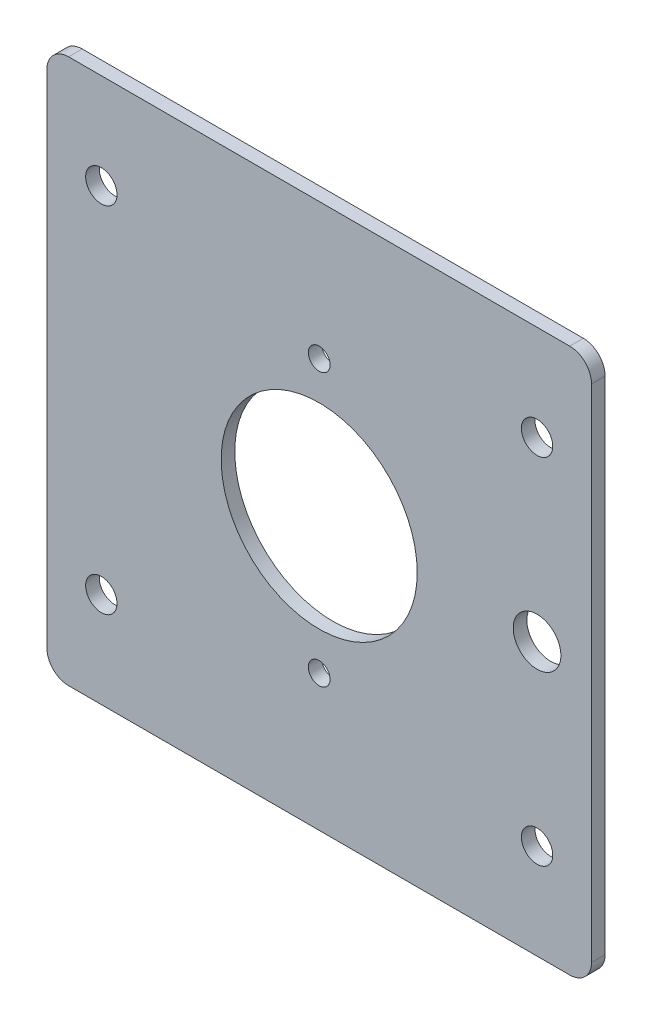
from build123d import *

# Parameters (mm, degrees)
SKETCH3_W                       = 63.5
SKETCH3_H                       = 1.5875
BASE_FLANGE1_DEPTH              = 31.75
FILLET1_R                       = 2.54
F_27_0_144_DIAMETER_HOLE1_D     = 3.6576
SKETCH10_R                      = 11.43
SKETCH10_R_2                    = 1.27
CUT_EXTRUDE1_DEPTH              = 45.929335141
F_7_32_0_21875_DIAMETER_HOLE1_D = 5.55625


# Sheet-metal steps are written as plain solids
with BuildPart() as part:
    # Sketch3 → Base-Flange1 (new, symmetric)
    with BuildSketch(Plane(origin=(0, 0, 0), x_dir=(-1, 0, 0), z_dir=(0, 1, 0))):
        with Locations((0, -0.79375)):
            Rectangle(SKETCH3_W, SKETCH3_H)
    extrude(amount=BASE_FLANGE1_DEPTH, both=True)

    # Fillet1
    fillet1_edges = [part.edges().sort_by_distance(p)[0] for p in [
        (31.75, 31.75, -0.79375),
        (31.75, -31.75, -0.79375),
        (-31.75, -31.75, -0.79375),
        (-31.75, 31.75, -0.79375),
    ]]
    fillet(fillet1_edges, radius=FILLET1_R)

    # #27 (0.144) Diameter Hole1 (through all)
    with Locations(Plane.XY):
        with Locations((-25.4, 20.6375), (25.4, 20.6375), (25.4, -20.6375), (-25.4, -20.6375)):
            Hole(F_27_0_144_DIAMETER_HOLE1_D / 2)

    # Sketch10 → Cut-Extrude1 (cut, through all)
    with BuildSketch(Plane.XY):
        Circle(SKETCH10_R)
        with Locations((0, 15.875)):
            Circle(SKETCH10_R_2)
        with Locations(Location((0, -15.875, 0), (0, 0, 180))):
            Circle(SKETCH10_R_2)
    extrude(amount=-CUT_EXTRUDE1_DEPTH, mode=Mode.SUBTRACT)

    # 7/32 (0.21875) Diameter Hole1 (through all)
    with Locations(Plane.XY):
        with Locations((25.4, 0)):
            Hole(F_7_32_0_21875_DIAMETER_HOLE1_D / 2)


solid = part.part
